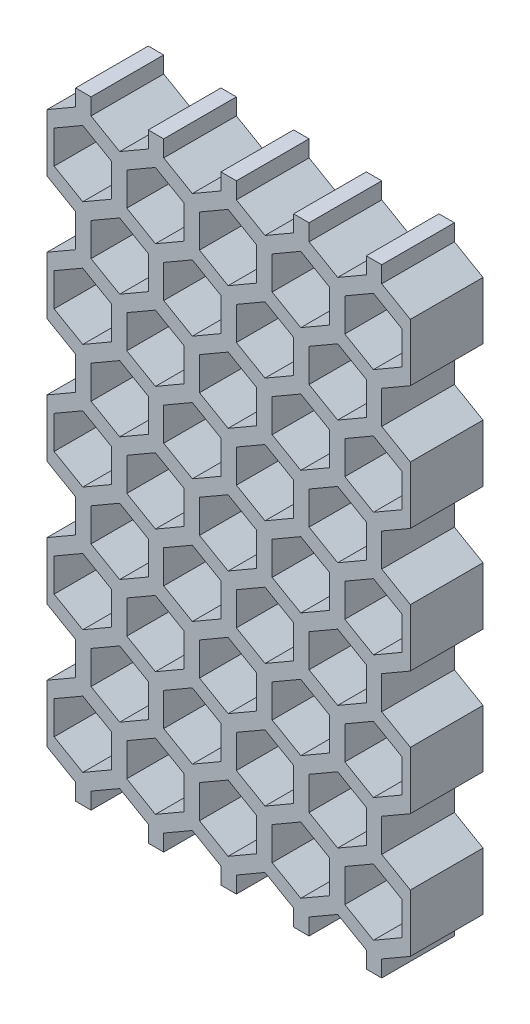
from build123d import *

# Parameters (mm, degrees)
BOSS_EXTRUDE1_DEPTH = 1.27


with BuildPart() as part:
    # Sketch1 → Boss-Extrude1 (new, symmetric)
    with BuildSketch(Plane.XY):
        Polygon((1.54, 0), (1, 0), (1, -0.577350269), (0, -1.154700538), (0, -3.163299462), (1, -3.740649731), (1, -4.895350269), (0, -5.472700538), (0, -7.481299462), (1, -8.058649731), (1, -9.213350269), (0, -9.790700538), (0, -11.799299462), (1, -12.376649731), (1, -13.531350269), (0, -14.108700538), (0, -16.117299462), (1, -16.694649731), (1, -17.849350269), (0, -18.426700538), (0, -20.435299462), (1, -21.012649731), (1, -21.59), (1.54, -21.59), (1.54, -21.012649731), (2.54, -20.435299462), (3.54, -21.012649731), (3.54, -21.59), (4.08, -21.59), (4.08, -21.012649731), (5.08, -20.435299462), (6.08, -21.012649731), (6.08, -21.59), (6.62, -21.59), (6.62, -21.012649731), (7.62, -20.435299462), (8.62, -21.012649731), (8.62, -21.59), (9.16, -21.59), (9.16, -21.012649731), (10.16, -20.435299462), (11.16, -21.012649731), (11.16, -21.59), (11.7, -21.59), (11.7, -21.012649731), (12.7, -20.435299462), (12.7, -18.426700538), (11.7, -17.849350269), (11.7, -16.694649731), (12.7, -16.117299462), (12.7, -14.108700538), (11.7, -13.531350269), (11.7, -12.376649731), (12.7, -11.799299462), (12.7, -9.790700538), (11.7, -9.213350269), (11.7, -8.058649731), (12.7, -7.481299462), (12.7, -5.472700538), (11.7, -4.895350269), (11.7, -3.740649731), (12.7, -3.163299462), (12.7, -1.154700538), (11.7, -0.577350269), (11.7, 0), (11.16, 0), (11.16, -0.577350269), (10.16, -1.154700538), (9.16, -0.577350269), (9.16, 0), (8.62, 0), (8.62, -0.577350269), (7.62, -1.154700538), (6.62, -0.577350269), (6.62, 0), (6.08, 0), (6.08, -0.577350269), (5.08, -1.154700538), (4.08, -0.577350269), (4.08, 0), (3.54, 0), (3.54, -0.577350269), (2.54, -1.154700538), (1.54, -0.577350269), align=None)
        Polygon((0.25, -18.85971324), (1.25, -18.282362971), (2.25, -18.85971324), (2.25, -20.014413779), (1.25, -20.591764048), (0.25, -20.014413779), align=None, mode=Mode.SUBTRACT)
        Polygon((2.79, -18.85971324), (3.79, -18.282362971), (4.79, -18.85971324), (4.79, -20.014413779), (3.79, -20.591764048), (2.79, -20.014413779), align=None, mode=Mode.SUBTRACT)
        Polygon((5.33, -18.85971324), (6.33, -18.282362971), (7.33, -18.85971324), (7.33, -20.014413779), (6.33, -20.591764048), (5.33, -20.014413779), align=None, mode=Mode.SUBTRACT)
        Polygon((1.54, -16.694649731), (2.54, -16.117299462), (3.54, -16.694649731), (3.54, -17.849350269), (2.54, -18.426700538), (1.54, -17.849350269), align=None, mode=Mode.SUBTRACT)
        Polygon((0.25, -14.54171324), (1.25, -13.964362971), (2.25, -14.54171324), (2.25, -15.696413779), (1.25, -16.273764048), (0.25, -15.696413779), align=None, mode=Mode.SUBTRACT)
        Polygon((1.54, -12.376649731), (2.54, -11.799299462), (3.54, -12.376649731), (3.54, -13.531350269), (2.54, -14.108700538), (1.54, -13.531350269), align=None, mode=Mode.SUBTRACT)
        Polygon((4.08, -16.694649731), (5.08, -16.117299462), (6.08, -16.694649731), (6.08, -17.849350269), (5.08, -18.426700538), (4.08, -17.849350269), align=None, mode=Mode.SUBTRACT)
        Polygon((2.79, -14.54171324), (3.79, -13.964362971), (4.79, -14.54171324), (4.79, -15.696413779), (3.79, -16.273764048), (2.79, -15.696413779), align=None, mode=Mode.SUBTRACT)
        Polygon((5.33, -14.54171324), (6.33, -13.964362971), (7.33, -14.54171324), (7.33, -15.696413779), (6.33, -16.273764048), (5.33, -15.696413779), align=None, mode=Mode.SUBTRACT)
        Polygon((4.08, -12.376649731), (5.08, -11.799299462), (6.08, -12.376649731), (6.08, -13.531350269), (5.08, -14.108700538), (4.08, -13.531350269), align=None, mode=Mode.SUBTRACT)
        Polygon((7.87, -18.85971324), (8.87, -18.282362971), (9.87, -18.85971324), (9.87, -20.014413779), (8.87, -20.591764048), (7.87, -20.014413779), align=None, mode=Mode.SUBTRACT)
        Polygon((10.41, -18.85971324), (11.41, -18.282362971), (12.41, -18.85971324), (12.41, -20.014413779), (11.41, -20.591764048), (10.41, -20.014413779), align=None, mode=Mode.SUBTRACT)
        Polygon((6.62, -16.694649731), (7.62, -16.117299462), (8.62, -16.694649731), (8.62, -17.849350269), (7.62, -18.426700538), (6.62, -17.849350269), align=None, mode=Mode.SUBTRACT)
        Polygon((9.16, -16.694649731), (10.16, -16.117299462), (11.16, -16.694649731), (11.16, -17.849350269), (10.16, -18.426700538), (9.16, -17.849350269), align=None, mode=Mode.SUBTRACT)
        Polygon((7.87, -14.54171324), (8.87, -13.964362971), (9.87, -14.54171324), (9.87, -15.696413779), (8.87, -16.273764048), (7.87, -15.696413779), align=None, mode=Mode.SUBTRACT)
        Polygon((6.62, -12.376649731), (7.62, -11.799299462), (8.62, -12.376649731), (8.62, -13.531350269), (7.62, -14.108700538), (6.62, -13.531350269), align=None, mode=Mode.SUBTRACT)
        Polygon((9.16, -12.376649731), (10.16, -11.799299462), (11.16, -12.376649731), (11.16, -13.531350269), (10.16, -14.108700538), (9.16, -13.531350269), align=None, mode=Mode.SUBTRACT)
        Polygon((10.41, -14.54171324), (11.41, -13.964362971), (12.41, -14.54171324), (12.41, -15.696413779), (11.41, -16.273764048), (10.41, -15.696413779), align=None, mode=Mode.SUBTRACT)
        Polygon((0.25, -10.22371324), (1.25, -9.646362971), (2.25, -10.22371324), (2.25, -11.378413779), (1.25, -11.955764048), (0.25, -11.378413779), align=None, mode=Mode.SUBTRACT)
        Polygon((1.54, -8.058649731), (2.54, -7.481299462), (3.54, -8.058649731), (3.54, -9.213350269), (2.54, -9.790700538), (1.54, -9.213350269), align=None, mode=Mode.SUBTRACT)
        Polygon((0.25, -5.90571324), (1.25, -5.328362971), (2.25, -5.90571324), (2.25, -7.060413779), (1.25, -7.637764048), (0.25, -7.060413779), align=None, mode=Mode.SUBTRACT)
        Polygon((2.79, -10.22371324), (3.79, -9.646362971), (4.79, -10.22371324), (4.79, -11.378413779), (3.79, -11.955764048), (2.79, -11.378413779), align=None, mode=Mode.SUBTRACT)
        Polygon((5.33, -10.22371324), (6.33, -9.646362971), (7.33, -10.22371324), (7.33, -11.378413779), (6.33, -11.955764048), (5.33, -11.378413779), align=None, mode=Mode.SUBTRACT)
        Polygon((4.08, -8.058649731), (5.08, -7.481299462), (6.08, -8.058649731), (6.08, -9.213350269), (5.08, -9.790700538), (4.08, -9.213350269), align=None, mode=Mode.SUBTRACT)
        Polygon((2.79, -5.90571324), (3.79, -5.328362971), (4.79, -5.90571324), (4.79, -7.060413779), (3.79, -7.637764048), (2.79, -7.060413779), align=None, mode=Mode.SUBTRACT)
        Polygon((5.33, -5.90571324), (6.33, -5.328362971), (7.33, -5.90571324), (7.33, -7.060413779), (6.33, -7.637764048), (5.33, -7.060413779), align=None, mode=Mode.SUBTRACT)
        Polygon((1.54, -3.740649731), (2.54, -3.163299462), (3.54, -3.740649731), (3.54, -4.895350269), (2.54, -5.472700538), (1.54, -4.895350269), align=None, mode=Mode.SUBTRACT)
        Polygon((0.25, -1.58771324), (1.25, -1.010362971), (2.25, -1.58771324), (2.25, -2.742413779), (1.25, -3.319764048), (0.25, -2.742413779), align=None, mode=Mode.SUBTRACT)
        Polygon((2.79, -1.58771324), (3.79, -1.010362971), (4.79, -1.58771324), (4.79, -2.742413779), (3.79, -3.319764048), (2.79, -2.742413779), align=None, mode=Mode.SUBTRACT)
        Polygon((4.08, -3.740649731), (5.08, -3.163299462), (6.08, -3.740649731), (6.08, -4.895350269), (5.08, -5.472700538), (4.08, -4.895350269), align=None, mode=Mode.SUBTRACT)
        Polygon((5.33, -1.58771324), (6.33, -1.010362971), (7.33, -1.58771324), (7.33, -2.742413779), (6.33, -3.319764048), (5.33, -2.742413779), align=None, mode=Mode.SUBTRACT)
        Polygon((7.87, -10.22371324), (8.87, -9.646362971), (9.87, -10.22371324), (9.87, -11.378413779), (8.87, -11.955764048), (7.87, -11.378413779), align=None, mode=Mode.SUBTRACT)
        Polygon((6.62, -8.058649731), (7.62, -7.481299462), (8.62, -8.058649731), (8.62, -9.213350269), (7.62, -9.790700538), (6.62, -9.213350269), align=None, mode=Mode.SUBTRACT)
        Polygon((9.16, -8.058649731), (10.16, -7.481299462), (11.16, -8.058649731), (11.16, -9.213350269), (10.16, -9.790700538), (9.16, -9.213350269), align=None, mode=Mode.SUBTRACT)
        Polygon((7.87, -5.90571324), (8.87, -5.328362971), (9.87, -5.90571324), (9.87, -7.060413779), (8.87, -7.637764048), (7.87, -7.060413779), align=None, mode=Mode.SUBTRACT)
        Polygon((10.41, -10.22371324), (11.41, -9.646362971), (12.41, -10.22371324), (12.41, -11.378413779), (11.41, -11.955764048), (10.41, -11.378413779), align=None, mode=Mode.SUBTRACT)
        Polygon((10.41, -5.90571324), (11.41, -5.328362971), (12.41, -5.90571324), (12.41, -7.060413779), (11.41, -7.637764048), (10.41, -7.060413779), align=None, mode=Mode.SUBTRACT)
        Polygon((6.62, -3.740649731), (7.62, -3.163299462), (8.62, -3.740649731), (8.62, -4.895350269), (7.62, -5.472700538), (6.62, -4.895350269), align=None, mode=Mode.SUBTRACT)
        Polygon((7.87, -1.58771324), (8.87, -1.010362971), (9.87, -1.58771324), (9.87, -2.742413779), (8.87, -3.319764048), (7.87, -2.742413779), align=None, mode=Mode.SUBTRACT)
        Polygon((9.16, -3.740649731), (10.16, -3.163299462), (11.16, -3.740649731), (11.16, -4.895350269), (10.16, -5.472700538), (9.16, -4.895350269), align=None, mode=Mode.SUBTRACT)
        Polygon((10.41, -1.58771324), (11.41, -1.010362971), (12.41, -1.58771324), (12.41, -2.742413779), (11.41, -3.319764048), (10.41, -2.742413779), align=None, mode=Mode.SUBTRACT)
    extrude(amount=BOSS_EXTRUDE1_DEPTH, both=True)


solid = part.part
